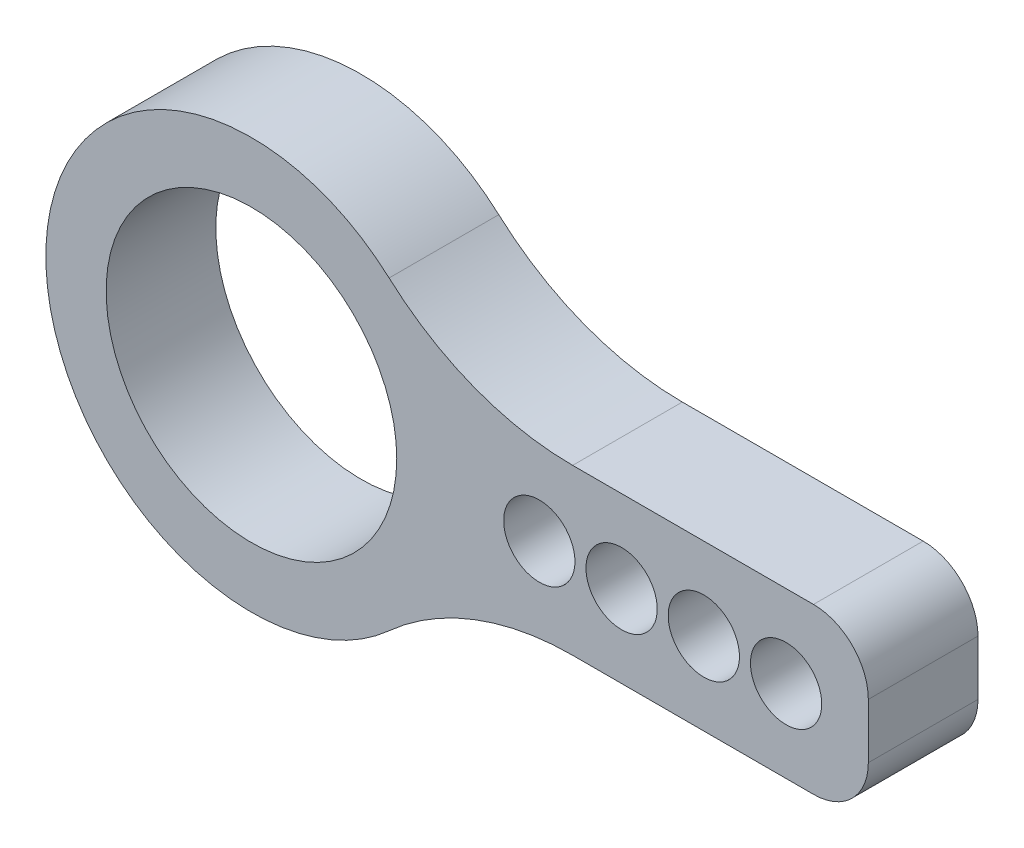
from build123d import *

# Parameters (mm, degrees)
SKETCH_1_R      = 1.3
SKETCH_1_R_2    = 5.3
EXTRUDE_1_DEPTH = 4
FILLET_1_R      = 10
FILLET_2_R      = 2


with BuildPart() as part:
    # ｽｹｯﾁ1 → ﾎﾞｽ - 押し出し1 (new body)
    with BuildSketch(Plane.XY):
        with BuildLine():
            Line((-20.126136458, -3), (-4.5, -3))
            Line((-4.5, -3), (-4.5, 3))
            Line((-4.5, 3), (-20.126136458, 3))
            ThreePointArc((-20.126136458, 3), (-34.5, 0), (-20.126136458, -3))
        make_face()
        with Locations((-16.5, 0)):
            Circle(SKETCH_1_R, mode=Mode.SUBTRACT)
        with Locations((-13.5, 0)):
            Circle(SKETCH_1_R, mode=Mode.SUBTRACT)
        with Locations((-10.5, 0)):
            Circle(SKETCH_1_R, mode=Mode.SUBTRACT)
        with Locations((-7.5, 0)):
            Circle(SKETCH_1_R, mode=Mode.SUBTRACT)
        with Locations((-27, 0)):
            Circle(SKETCH_1_R_2, mode=Mode.SUBTRACT)
    extrude(amount=EXTRUDE_1_DEPTH)

    # ﾌｨﾚｯﾄ1
    fillet_1_edges = [part.edges().sort_by_distance(p)[0] for p in [
        (-20.126136458, 3, 2),
        (-20.126136458, -3, 2),
    ]]
    fillet(fillet_1_edges, radius=FILLET_1_R)

    # ﾌｨﾚｯﾄ2
    fillet_2_edges = [part.edges().sort_by_distance(p)[0] for p in [
        (-4.5, 3, 2),
        (-4.5, -3, 2),
    ]]
    fillet(fillet_2_edges, radius=FILLET_2_R)


solid = part.part
